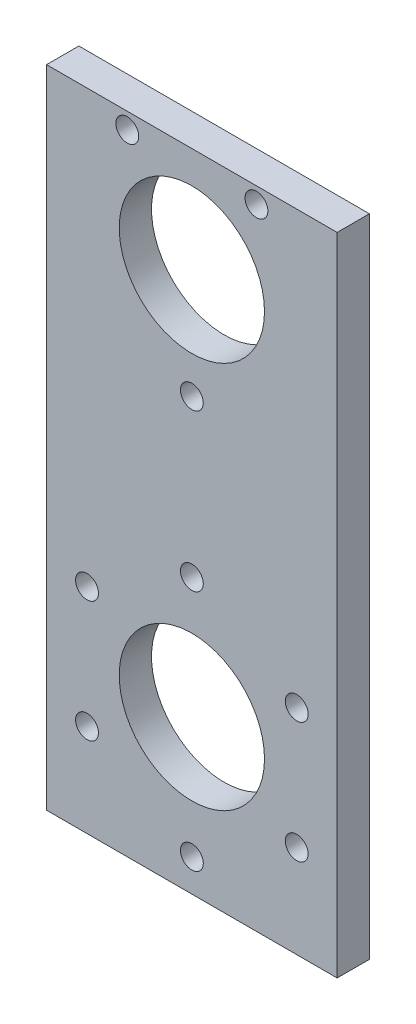
from build123d import *

# Parameters (mm, degrees)
SKETCH1_W             = 57.15
SKETCH1_H             = 136.525
SKETCH1_R             = 14.2875
BOSS_EXTRUDE1_DEPTH   = 3.175
F_8_CLEARANCE_HOLE1_D = 4.4958
F_8_CLEARANCE_HOLE2_D = 4.4958
SKETCH9_W             = 57.15
SKETCH9_H             = 9.525
CUT_EXTRUDE1_DEPTH    = 75.27396604


with BuildPart() as part:
    # Sketch1 → Boss-Extrude1 (new, symmetric)
    with BuildSketch(Plane.XY):
        Rectangle(SKETCH1_W, SKETCH1_H)
        with Locations((0, 38.1)):
            Circle(SKETCH1_R, mode=Mode.SUBTRACT)
        with Locations((0, -38.1)):
            Circle(SKETCH1_R, mode=Mode.SUBTRACT)
    extrude(amount=BOSS_EXTRUDE1_DEPTH, both=True)

    # #8 Clearance Hole1 (through all)
    with Locations(Plane.XY.offset(3.175)):
        with Locations((0, -14.2875), (20.622229928, -26.19375), (20.622229928, -50.00625), (0, -61.9125), (-20.622229928, -50.00625), (-20.622229928, -26.19375), (0, -38.1)):
            Hole(F_8_CLEARANCE_HOLE1_D / 2)

    # #8 Clearance Hole2 (through all)
    with Locations(Plane.XY.offset(3.175)):
        with Locations((-12.7, 55.5625), (12.7, 55.5625), (0, 16.51)):
            Hole(F_8_CLEARANCE_HOLE2_D / 2)

    # Sketch9 → Cut-Extrude1 (cut, through all)
    with BuildSketch(Plane.XY.offset(3.175)):
        with Locations((0, 63.5)):
            Rectangle(SKETCH9_W, SKETCH9_H)
    extrude(amount=-CUT_EXTRUDE1_DEPTH, mode=Mode.SUBTRACT)


solid = part.part
